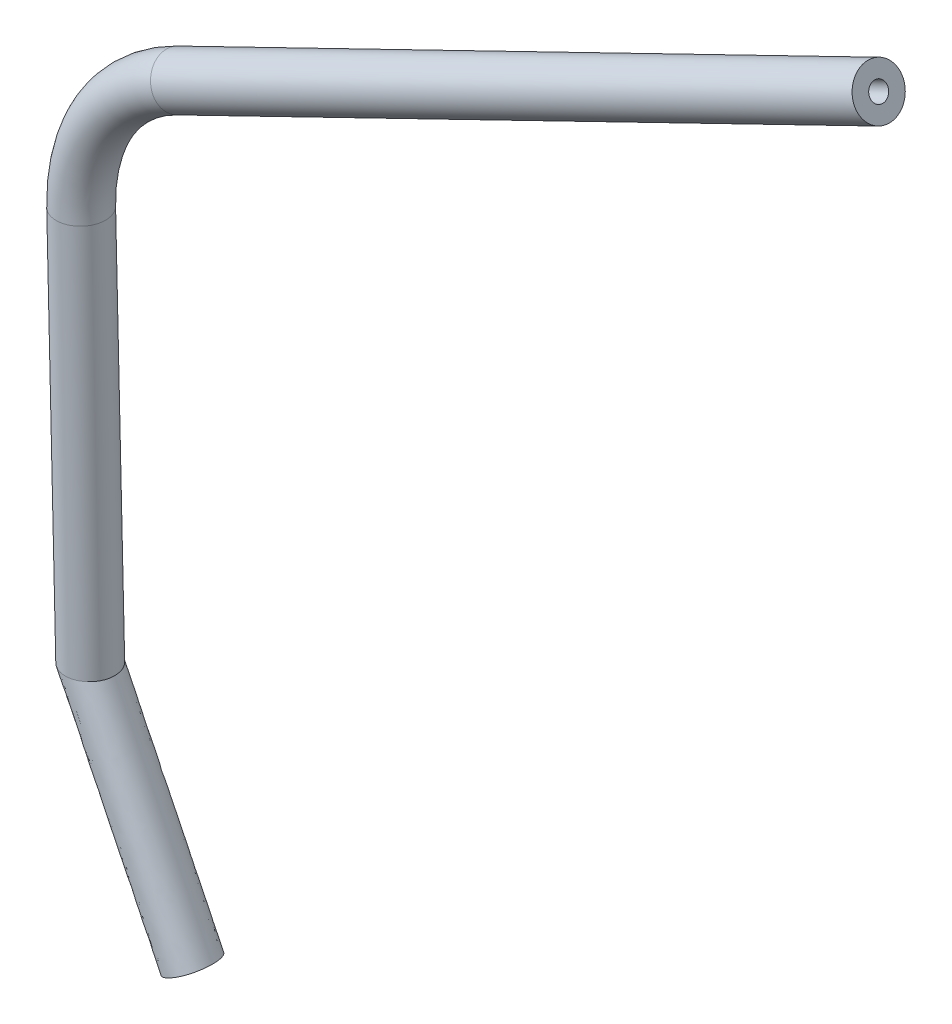
from build123d import *

# Parameters (mm, degrees)
SKETCH5_R               = 12.7
SKETCH5_R_2             = 4.7625
SKETCH6_R               = 12.7
SKETCH6_R_2             = 4.7625
BOSS_EXTRUDE3_DEPTH     = 406.4
SKETCH7_R               = 12.7
SKETCH7_R_2             = 4.7625
BOSS_EXTRUDE4_DEPTH     = 203.2
SKETCH9_R               = 12.7
CUT_EXTRUDE2_DEPTH      = 6.35
SKETCH10_R              = 12.7
SKETCH10_R_2            = 4.7625
CUT_EXTRUDE3_DEPTH      = 462.222817168
CUT_EXTRUDE3_DEPTH_BACK = 462.222817168


with BuildPart() as part:
    # Sweep1: sweep along a path in Sketch4
    with BuildLine(Plane.XY) as sweep1_path:
        ThreePointArc((-38.874671546, 79.949796199), (-75.907697444, 46.273442371), (-88.87582946, -2.072905643))
    # Sketch5 → Sweep1 (sweep)
    with BuildSketch(Plane(origin=(0, 0, 0), x_dir=(1, 0, 0), z_dir=(0, 1, 0))):
        with Locations((-88.87582946, 0)):
            Circle(SKETCH5_R)
        with Locations((-88.87582946, 0)):
            Circle(SKETCH5_R_2, mode=Mode.SUBTRACT)
    sweep(path=sweep1_path.line)

    # Sketch6 → Boss-Extrude3 (add)
    with BuildSketch(Plane(origin=(0, 0, 0), x_dir=(0, 0, -1), z_dir=(0.8993227918843839, 0.43728539421901275, 0))):
        with Locations((0, 88.87582946)):
            Circle(SKETCH6_R)
        with Locations((0, 88.87582946)):
            Circle(SKETCH6_R_2, mode=Mode.SUBTRACT)
    extrude(amount=BOSS_EXTRUDE3_DEPTH)

    # Sketch7 → Boss-Extrude4 (add)
    with BuildSketch(Plane(origin=(0, 0, 0), x_dir=(-0.9997281154099812, -0.023317273828803834, 0), z_dir=(0.023317273828803834, -0.9997281154099812, 0))):
        with Locations((88.87582946, 0)):
            Circle(SKETCH7_R)
        with Locations((88.87582946, 0)):
            Circle(SKETCH7_R_2, mode=Mode.SUBTRACT)
    extrude(amount=BOSS_EXTRUDE4_DEPTH)

    # Sketch9 → Cut-Extrude2 (cut)
    with BuildSketch(Plane(origin=(0, 0, -12.7), x_dir=(-1, 0, 0), z_dir=(0, 0, -1))):
        with Locations((76.269889492, 46.494235168)):
            Circle(SKETCH9_R)
    extrude(amount=-CUT_EXTRUDE2_DEPTH, mode=Mode.SUBTRACT)

    # Sweep2: sweep along a path in Sketch11
    with BuildLine(Plane.XY) as sweep2_path:
        Line((-84.113595449, -205.217095104), (-28.578350384, -319.431089673))
    # Sketch10 → Sweep2 (sweep)
    with BuildSketch(Plane(origin=(4.738070042, -203.144753051, 0), x_dir=(-0.9997281154099812, -0.023317273828803834, 0), z_dir=(0.023317273828803834, -0.9997281154099812, 0))):
        with Locations((88.87582946, 0)):
            Circle(SKETCH10_R)
        with Locations((88.87582946, 0)):
            Circle(SKETCH10_R_2, mode=Mode.SUBTRACT)
    sweep(path=sweep2_path.line)

    # Sketch12 → Cut-Extrude3 (cut, two sides: drawn at the far end of the back side and taken through both)
    with BuildSketch(Plane.XY.offset(-CUT_EXTRUDE3_DEPTH_BACK)):
        Polygon((-41.274897449, -319.727219051), (-20.504520989, -309.627861689), (-15.881803318, -319.134960295), align=None)
    extrude(amount=CUT_EXTRUDE3_DEPTH + CUT_EXTRUDE3_DEPTH_BACK, mode=Mode.SUBTRACT)


solid = part.part
